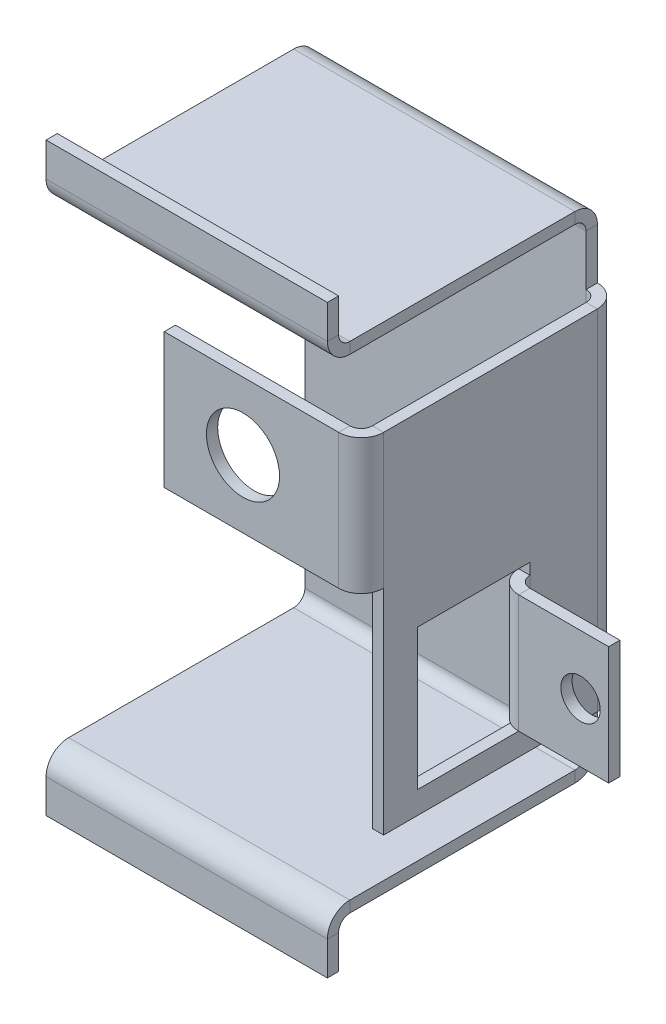
from build123d import *

# Parameters (mm, degrees)
BASE_FLANGE1_DEPTH = 50
EDGE_FLANGE1_DEPTH = 62
SKETCH9_W          = 25
SKETCH9_H          = 20
CUT_EXTRUDE1_DEPTH = 10
EDGE_FLANGE2_DEPTH = 21
SKETCH13_R         = 3.5
CUT_EXTRUDE2_DEPTH = 10
EDGE_FLANGE3_DEPTH = 24
SKETCH17_R         = 6.5
CUT_EXTRUDE3_DEPTH = 10


# Sheet-metal steps are written as plain solids
with BuildPart() as part:
    # Sketch1 → Base-Flange1 (new body)
    with BuildSketch(Plane.YZ):
        with BuildLine():
            Line((-52, 46), (-46, 46))
            ThreePointArc((-46, 46), (-43.171572875, 44.828427125), (-42, 42))
            Line((-42, 42), (-42, 2))
            ThreePointArc((-42, 2), (-41.414213562, 0.585786438), (-40, 0))
            Line((-40, 0), (40, 0))
            ThreePointArc((40, 0), (41.414213562, 0.585786438), (42, 2))
            Line((42, 2), (42, 42))
            ThreePointArc((42, 42), (43.171572875, 44.828427125), (46, 46))
            Line((46, 46), (52, 46))
            Line((52, 46), (52, 44))
            Line((52, 44), (46, 44))
            ThreePointArc((46, 44), (44.585786438, 43.414213562), (44, 42))
            Line((44, 42), (44, 2))
            ThreePointArc((44, 2), (42.828427125, -0.828427125), (40, -2))
            Line((40, -2), (-40, -2))
            ThreePointArc((-40, -2), (-42.828427125, -0.828427125), (-44, 2))
            Line((-44, 2), (-44, 42))
            ThreePointArc((-44, 42), (-44.585786438, 43.414213562), (-46, 44))
            Line((-46, 44), (-52, 44))
            Line((-52, 44), (-52, 46))
        make_face()
    extrude(amount=-BASE_FLANGE1_DEPTH)

    # Edge-Flange1 section (across the edge) → Edge-Flange1 (add)
    with BuildSketch(Plane(origin=(2, -31, 0), x_dir=(-1, 0, 0), z_dir=(0, 1, 0))):
        with BuildLine():
            Line((-2, 2), (-2, 40))
            Line((-2, 40), (0, 40))
            Line((0, 40), (0, 2))
            ThreePointArc((0, 2), (0.585786438, 0.585786438), (2, 0))
            Line((2, 0), (2, -2))
            ThreePointArc((2, -2), (-0.828427125, -0.828427125), (-2, 2))
        make_face()
    extrude(amount=EDGE_FLANGE1_DEPTH)

    # Sketch9 → Cut-Extrude1 (cut)
    with BuildSketch(Plane.YZ.offset(4)):
        with Locations((-14.5, 24)):
            Rectangle(SKETCH9_W, SKETCH9_H)
    extrude(amount=-CUT_EXTRUDE1_DEPTH, mode=Mode.SUBTRACT)

    # Edge-Flange2 section (across the edge) → Edge-Flange2 (add)
    with BuildSketch(Plane(origin=(4, -4, 16), x_dir=(0, 0, -1), z_dir=(0, -1, 0))):
        with BuildLine():
            Line((-2, 2), (-2, 18))
            Line((-2, 18), (0, 18))
            Line((0, 18), (0, 2))
            ThreePointArc((0, 2), (0.585786438, 0.585786438), (2, 0))
            Line((2, 0), (2, -2))
            ThreePointArc((2, -2), (-0.828427125, -0.828427125), (-2, 2))
        make_face()
    extrude(amount=EDGE_FLANGE2_DEPTH)

    # Sketch13 → Cut-Extrude2 (cut)
    with BuildSketch(Plane.XY.offset(18)):
        with Locations((17, -14.5)):
            Circle(SKETCH13_R)
    extrude(amount=-CUT_EXTRUDE2_DEPTH, mode=Mode.SUBTRACT)

    # Edge-Flange3 section (across the edge) → Edge-Flange3 (add)
    with BuildSketch(Plane(origin=(2, 7, 42), x_dir=(0, 0, -1), z_dir=(0, 1, 0))):
        with BuildLine():
            Line((-2, 2), (-2, 33))
            Line((-2, 33), (0, 33))
            Line((0, 33), (0, 2))
            ThreePointArc((0, 2), (0.585786438, 0.585786438), (2, 0))
            Line((2, 0), (2, -2))
            ThreePointArc((2, -2), (-0.828427125, -0.828427125), (-2, 2))
        make_face()
    extrude(amount=EDGE_FLANGE3_DEPTH)

    # Sketch17 → Cut-Extrude3 (cut)
    with BuildSketch(Plane.XY.offset(44)):
        with Locations((-17, 19)):
            Circle(SKETCH17_R)
    extrude(amount=-CUT_EXTRUDE3_DEPTH, mode=Mode.SUBTRACT)


solid = part.part
